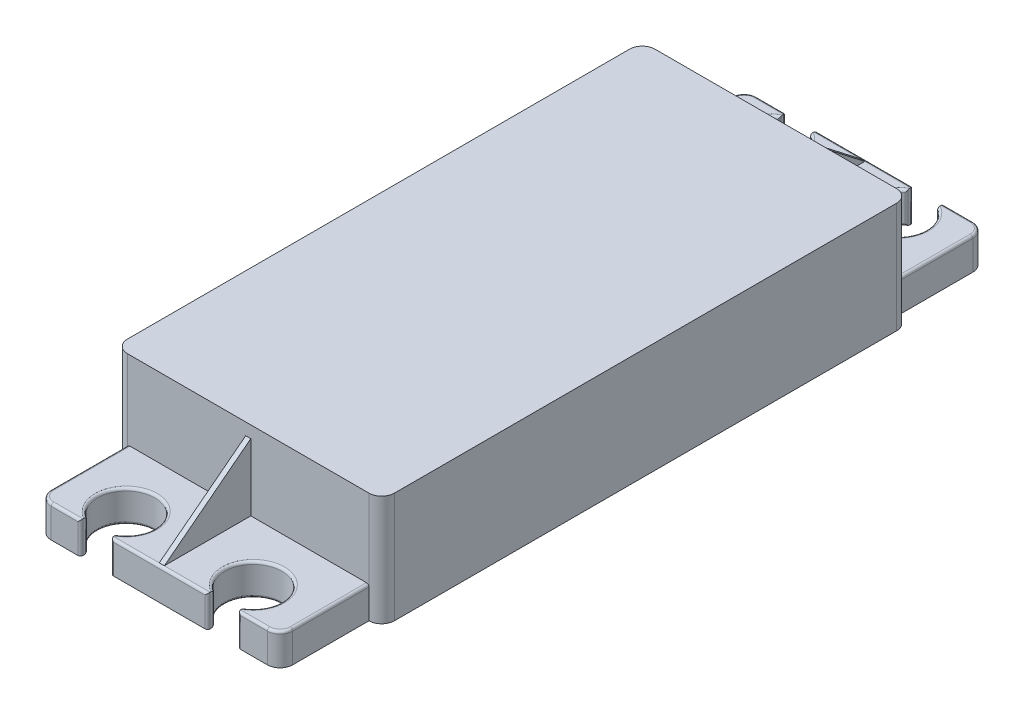
from build123d import *

# Parameters (mm, degrees)
SKETCH1_W           = 21
SKETCH1_H           = 41.5
BOSS_EXTRUDE1_DEPTH = 8.7
FILLET4_R           = 1
SKETCH3_W           = 9.5
SKETCH3_H           = 2.5
BOSS_EXTRUDE2_DEPTH = 7
CUT_EXTRUDE2_DEPTH  = 32.824057331
FILLET5_R           = 1
FILLET6_R           = 0.2
RIB1_REACH          = 32.248
SKETCH9_WALL_W      = 71.09395944
SKETCH9_WALL_H      = 0.4


# Read off the part's stored shape, not the designer's step: Mirror1
with BuildPart() as part:
    # Sketch1 → Boss-Extrude1 (new body)
    with BuildSketch(Plane(origin=(0, 0, 0), x_dir=(1, 0, 0), z_dir=(0, 1, 0))):
        with Locations((-3.925, -6.25)):
            Rectangle(SKETCH1_W, SKETCH1_H)
    extrude(amount=BOSS_EXTRUDE1_DEPTH)

    # Fillet4
    fillet4_edges = [part.edges().sort_by_distance(p)[0] for p in [
        (-14.425, 4.35, -14.5),
        (6.575, 4.35, -14.5),
        (6.575, 4.35, 27),
        (-14.425, 4.35, 27),
    ]]
    fillet(fillet4_edges, radius=FILLET4_R)

    # Sketch3 → Boss-Extrude2 (add)
    with BuildSketch(Plane(origin=(0, 0, -14.5), x_dir=(-1, 0, 0), z_dir=(0, 0, -1))):
        with Locations((-0.825, 1.25)):
            Rectangle(SKETCH3_W, SKETCH3_H)
        with Locations((8.675, 1.25)):
            Rectangle(SKETCH3_W, SKETCH3_H)
    extrude(amount=BOSS_EXTRUDE2_DEPTH)

    # Sketch4 → Cut-Extrude2 (cut, through all)
    with BuildSketch(Plane.XZ):
        with BuildLine():
            Line((-10.125, -21.5), (-7.725, -21.5))
            Line((-7.725, -21.5), (-7.725, -21.003286631))
            ThreePointArc((-7.725, -21.003286631), (-8.925, -16.85), (-10.125, -21.003286631))
            Line((-10.125, -21.003286631), (-10.125, -21.5))
        make_face()
        with BuildLine():
            Line((-0.125, -21.003286631), (-0.125, -21.5))
            Line((-0.125, -21.5), (2.275, -21.5))
            Line((2.275, -21.5), (2.275, -21.003286631))
            ThreePointArc((2.275, -21.003286631), (1.075, -16.85), (-0.125, -21.003286631))
        make_face()
    extrude(amount=-CUT_EXTRUDE2_DEPTH, mode=Mode.SUBTRACT)

    # Fillet5
    fillet5_edges = [part.edges().sort_by_distance(p)[0] for p in [
        (-13.425, 1.25, -21.5),
        (5.575, 1.25, -21.5),
    ]]
    fillet(fillet5_edges, radius=FILLET5_R)

    # Fillet6
    fillet6_edges = [part.edges().sort_by_distance(p)[0] for p in [
        (-11.275, 2.5, -21.5),
        (-10.125, 1.25, -21.5),
        (-7.725, 1.25, -21.5),
        (-8.925, 2.5, -16.85),
        (-7.725, 1.25, -21.003286631),
        (-10.125, 1.25, -21.003286631),
        (-8.925, 0, -16.85),
        (-3.925, 2.5, -21.5),
        (-0.125, 1.25, -21.5),
        (2.275, 1.25, -21.5),
        (1.075, 2.5, -16.85),
        (-0.125, 1.25, -21.003286631),
        (1.075, 0, -16.85),
        (2.275, 1.25, -21.003286631),
        (3.425, 2.5, -21.5),
        (5.575, 2.5, -17.5),
        (-13.425, 2.5, -17.5),
        (-13.132106781, 2.5, -21.207106781),
        (5.282106781, 2.5, -21.207106781),
    ]]
    fillet(fillet6_edges, radius=FILLET6_R)

    # Sketch9 wall → Rib1 (add, up to next)
    with BuildSketch(Plane(origin=(-3.925, 5.130863051, -17.9), x_dir=(0, 0.611970283054, 0.790880757548), z_dir=(0, -0.790880757548, 0.611970283054)), mode=Mode.PRIVATE) as rib1_sk1:
        Rectangle(SKETCH9_WALL_W, SKETCH9_WALL_H)
    rib1_tool1 = extrude(rib1_sk1.sketch, amount=RIB1_REACH, mode=Mode.PRIVATE) - part.part
    add(rib1_tool1.solids().sort_by_distance((-3.925, 5.130863051, -17.9))[0])

    # Mirror1: part across plane


with BuildPart() as part_1:
    add(part.part)
    add(part.part.mirror(Plane.XY.offset(6.25)))


solid = part_1.part
